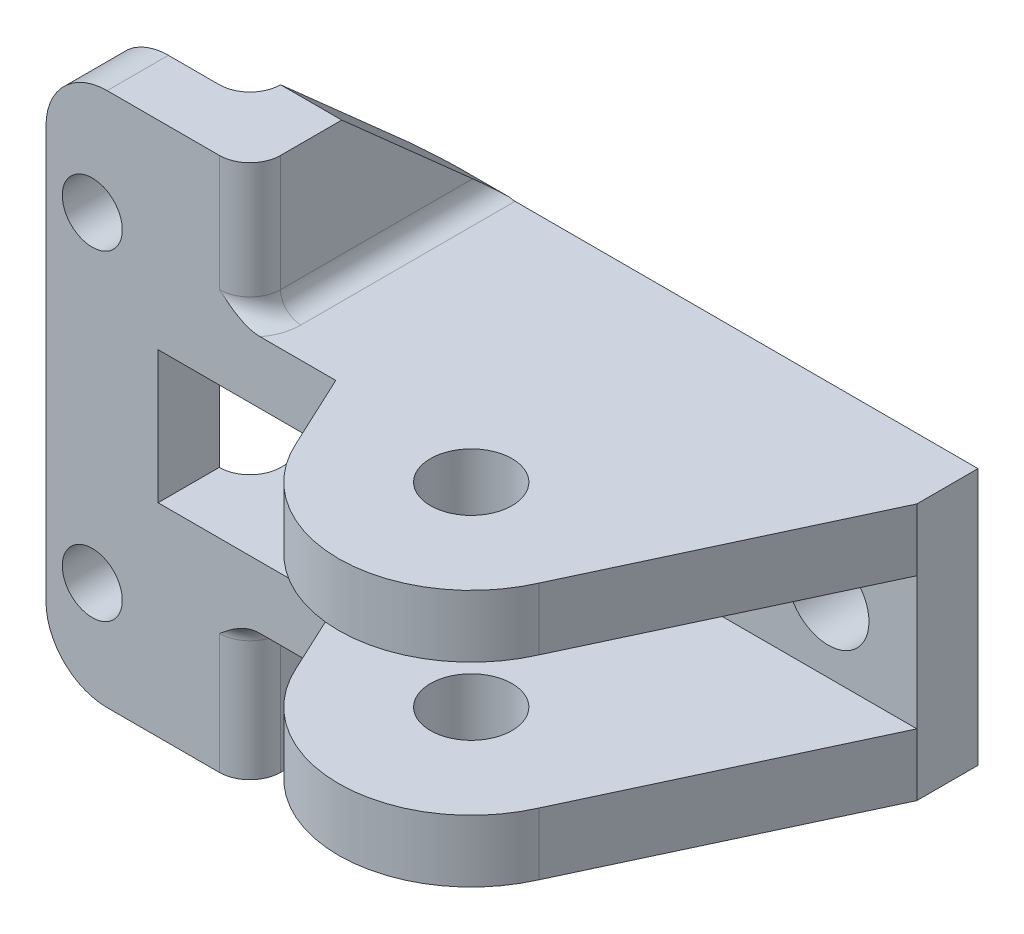
from build123d import *

# Parameters (mm, degrees)
ESQUISSE1_W             = 23.695260015
ESQUISSE1_H             = 12.6
ESQUISSE1_R             = 2
BOSS_EXTRU_1_DEPTH      = 3
ESQUISSE3_R             = 2
BOSS_EXTRU_2_DEPTH      = 12.6
BOSS_EXTRU_4_DEPTH      = 6.7
BOSS_EXTRU_4_DEPTH_BACK = 19.5
ENL_V_MAT_EXTRU_2_DEPTH = 3
ESQUISSE8_W             = 8.43757856
ESQUISSE8_H             = 12
BOSS_EXTRU_5_DEPTH      = 12.6
ESQUISSE5_W             = 20.633758591
ESQUISSE5_H             = 6.5
ENL_V_MAT_EXTRU_1_DEPTH = 28.2
CONG_3_R                = 1
ESQUISSE9_R             = 2
ENL_V_MAT_EXTRU_3_DEPTH = 3.6
ESQUISSE11_R            = 1.47
ENL_V_MAT_EXTRU_4_DEPTH = 3.6
CONG_4_R                = 3


with BuildPart() as part:
    # Esquisse1 → Boss.-Extru.1 (new body)
    with BuildSketch(Plane.XY):
        with Locations((-5.99209908, 12.295954438)):
            Rectangle(ESQUISSE1_W, ESQUISSE1_H)
        with Locations((-13.489729087, 12.425985115)):
            Circle(ESQUISSE1_R, mode=Mode.SUBTRACT)
        with Locations((1.510270913, 12.425985115)):
            Circle(ESQUISSE1_R, mode=Mode.SUBTRACT)
    extrude(amount=BOSS_EXTRU_1_DEPTH)

    # Esquisse3 → Boss.-Extru.2 (add)
    with BuildSketch(Plane.XZ.offset(-5.995954438)):
        with BuildLine():
            Line((-17.839729087, 3), (5.855530928, 3))
            Line((5.855530928, 3), (-0.041538546, 15.615497913))
            ThreePointArc((-0.041538546, 15.615497913), (-5.99209908, 19.5), (-11.942659613, 15.615497913))
            Line((-11.942659613, 15.615497913), (-17.839729087, 3))
        make_face()
        with Locations(Location((-5.99209908, 13, 0), (0, 0, 270))):
            Circle(ESQUISSE3_R, mode=Mode.SUBTRACT)
    extrude(amount=-BOSS_EXTRU_2_DEPTH)

    # Esquisse6 → Boss.-Extru.4 (add, two sides: drawn at the far end of the back side and taken through both)
    with BuildSketch(Plane(origin=(0, 18.595954438, 0), x_dir=(1, 0, 0), z_dir=(0, 1, 0)).offset(-BOSS_EXTRU_4_DEPTH_BACK)):
        with BuildLine():
            Line((-17.839729087, -3), (-17.839729087, 0))
            Line((-17.839729087, 0), (-19.339729087, 0))
            ThreePointArc((-19.339729087, 0), (-20.400389259, -0.439339828), (-20.839729087, -1.5))
            Line((-20.839729087, -1.5), (-20.839729087, -7.5))
            ThreePointArc((-20.839729087, -7.5), (-21.279068915, -8.560660172), (-22.339729087, -9))
            Line((-22.339729087, -9), (-27.839729087, -9))
            Line((-27.839729087, -9), (-27.839729087, -12))
            Line((-27.839729087, -12), (-19.944823835, -12))
            Line((-19.944823835, -12), (-19.339729087, -12))
            ThreePointArc((-19.339729087, -12), (-18.279068915, -11.560660172), (-17.839729087, -10.5))
            Line((-17.839729087, -10.5), (-17.839729087, -8.3919439))
            Line((-17.839729087, -8.3919439), (-17.839729087, -3))
        make_face()
    extrude(amount=BOSS_EXTRU_4_DEPTH + BOSS_EXTRU_4_DEPTH_BACK)

    # Esquisse7 → Enlèv. mat.-Extru.2 (cut)
    with BuildSketch(Plane.ZY.offset(20.839729087)):
        Polygon((-6.140344815, 12.195954438), (-6.42704232, 7.753847566), (-3.772480019, -6.539015172), (6.059758422, -5.019044791), (7.5, -0.904045562), (-0.069254369, 5.816985209), (-0.466179864, 12.195954438), (-0.069254369, 18.574923667), (7.5, 25.295954438), (6.059758422, 29.410953667), (-3.772480019, 30.930924048), (-6.42704232, 16.638061311), align=None)
    extrude(amount=-ENL_V_MAT_EXTRU_2_DEPTH, mode=Mode.SUBTRACT)

    # Esquisse8 → Boss.-Extru.5 (add)
    with BuildSketch(Plane(origin=(0, 5.995954438, 0), x_dir=(-1, 0, 0), z_dir=(0, -1, 0))):
        with Locations((15.523391269, -6)):
            Rectangle(ESQUISSE8_W, ESQUISSE8_H)
    extrude(amount=-BOSS_EXTRU_5_DEPTH)

    # Esquisse5 → Enlèv. mat.-Extru.1 (cut)
    with BuildSketch(Plane(origin=(5.855530928, 0, 0), x_dir=(0, 0, -1), z_dir=(1, 0, 0))):
        with Locations((-13.316879296, 12.295954438)):
            Rectangle(ESQUISSE5_W, ESQUISSE5_H)
    extrude(amount=-ENL_V_MAT_EXTRU_1_DEPTH, mode=Mode.SUBTRACT)

    # Congé3
    # the kernel refuses this fillet: 1 mm, written as the material it adds along each edge
    with BuildSketch(Plane(origin=(-19.339729087, 18.595954438, 10.5), x_dir=(1, 0, 0), z_dir=(0, 0, -1))) as cong_3_piece_1_section:
        with BuildLine():
            CenterArc((1.5 + CONG_3_R, -CONG_3_R), CONG_3_R, 90, 90)
            Line((1.5, -CONG_3_R), (1.5, 0))
            Line((1.5, 0), (1.5 + CONG_3_R, 0))
        make_face()
    cong_3_piece_1 = revolve(axis=Axis((-19.339729087, 18.595954438, 10.5), (0, -1, 0)), revolution_arc=185.531326158, mode=Mode.PRIVATE)
    cong_3_piece_1 = split(cong_3_piece_1, bisect_by=Plane(origin=(-17.625243019, 18.758648555, 12), z_dir=(0, 0, -1)), keep=Keep.TOP, mode=Mode.PRIVATE)
    add(cong_3_piece_1)
    with BuildSketch(Plane(origin=(-19.339729087, 5.995954438, 10.5), x_dir=(1, 0, 0), z_dir=(0, 0, -1))) as cong_3_piece_2_section:
        with BuildLine():
            CenterArc((1.5 + CONG_3_R, CONG_3_R), CONG_3_R, 180, 90)
            Line((1.5 + CONG_3_R, 0), (1.5, 0))
            Line((1.5, 0), (1.5, CONG_3_R))
        make_face()
    cong_3_piece_2 = revolve(axis=Axis((-19.339729087, 5.995954438, 10.5), (0, -1, 0)), revolution_arc=185.531326158, mode=Mode.PRIVATE)
    cong_3_piece_2 = split(cong_3_piece_2, bisect_by=Plane(origin=(-18.22928563, 5.709154501, 12), z_dir=(0, 0, -1)), keep=Keep.TOP, mode=Mode.PRIVATE)
    add(cong_3_piece_2)
    with BuildSketch(Plane(origin=(-17.839729087, 18.595954438, 0), x_dir=(1, 0, 0), z_dir=(0, 0, 1))) as cong_3_piece_3_section:
        with BuildLine():
            CenterArc((CONG_3_R, CONG_3_R), CONG_3_R, 180, 90)
            Line((0, CONG_3_R), (0, 0))
            Line((0, 0), (CONG_3_R, 0))
        make_face()
    cong_3_piece_3 = extrude(amount=10.5, mode=Mode.PRIVATE)
    cong_3_piece_3 = split(cong_3_piece_3, bisect_by=Plane(origin=(-17.614169597, 21.372960388, 3.081906873), z_dir=(0, -0.7477621735263639, 0.6639666647077458)), keep=Keep.TOP, mode=Mode.PRIVATE)
    add(cong_3_piece_3)
    with BuildSketch(Plane(origin=(-17.839729087, 5.995954438, 0), x_dir=(1, 0, 0), z_dir=(0, 0, 1))) as cong_3_piece_4_section:
        with BuildLine():
            CenterArc((CONG_3_R, -CONG_3_R), CONG_3_R, 90, 90)
            Line((0, -CONG_3_R), (0, 0))
            Line((0, 0), (CONG_3_R, 0))
        make_face()
    cong_3_piece_4 = extrude(amount=10.5, mode=Mode.PRIVATE)
    cong_3_piece_4 = split(cong_3_piece_4, bisect_by=Plane(origin=(-17.615177954, 3.13865295, 2.947095183), z_dir=(0, 0.747762173526364, 0.6639666647077457)), keep=Keep.TOP, mode=Mode.PRIVATE)
    add(cong_3_piece_4)

    # Esquisse9 → Enlèv. mat.-Extru.3 (cut)
    with BuildSketch(Plane(origin=(0, 0, 0), x_dir=(-1, 0, 0), z_dir=(0, 0, -1))):
        with Locations((13.489729087, 12.425985115)):
            Circle(ESQUISSE9_R)
    extrude(amount=-ENL_V_MAT_EXTRU_3_DEPTH, mode=Mode.SUBTRACT)

    # Esquisse11 → Enlèv. mat.-Extru.4 (cut)
    with BuildSketch(Plane(origin=(0, 0, 9), x_dir=(-1, 0, 0), z_dir=(0, 0, -1))):
        with Locations((25.570191421, 4.024422561)):
            Circle(ESQUISSE11_R)
        with Locations((25.570191421, 19.752422561)):
            Circle(ESQUISSE11_R)
    extrude(amount=-ENL_V_MAT_EXTRU_4_DEPTH, mode=Mode.SUBTRACT)

    # Congé4
    cong_4_edges = [part.edges().sort_by_distance(p)[0] for p in [
        (-27.839729087, 25.295954438, 10.5),
        (-27.839729087, -0.904045562, 10.5),
    ]]
    fillet(cong_4_edges, radius=CONG_4_R)


solid = part.part
